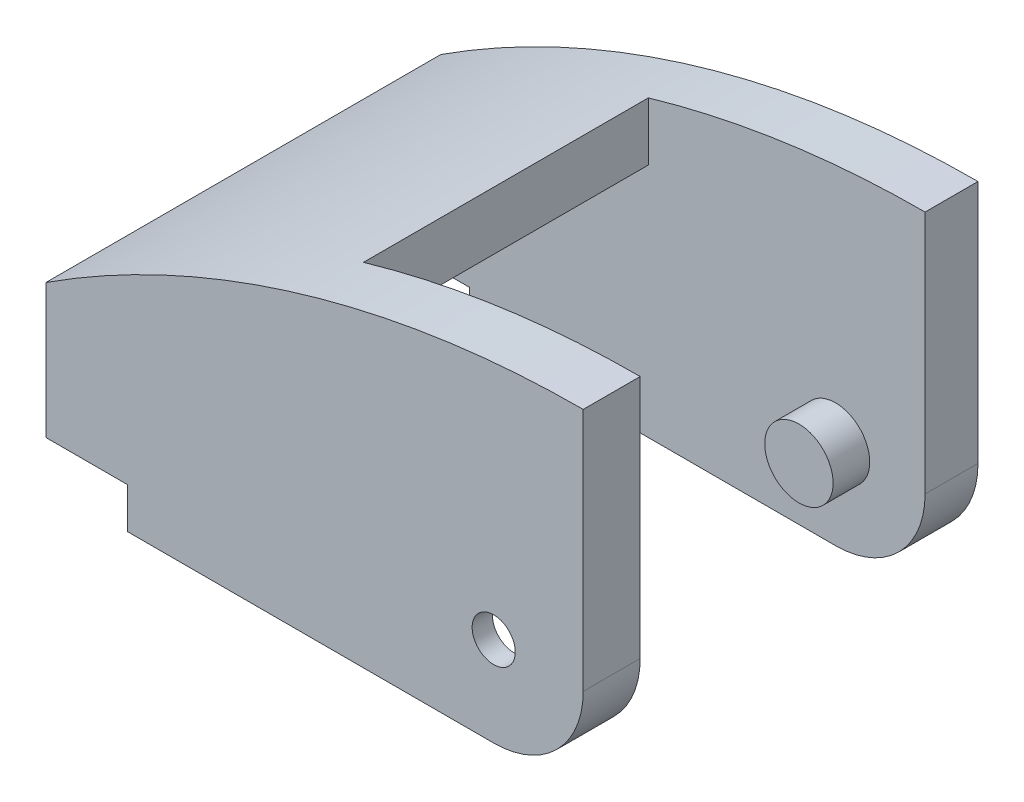
from build123d import *
from build123d.topology import SkipClean

# Parameters (mm, degrees)
SKETCH1_R              = 9.5
BOSS_EXTRUDE1_DEPTH    = 48
CUT_EXTRUDE1_DEPTH     = 62.48170459575759
BOSS_EXTRUDE2_START    = -2.5
SKETCH3_R              = 9.5
SKETCH3_R_2            = 2.4
BOSS_EXTRUDE2_DEPTH    = 2.5
SKETCH4_R              = 9.5
SKETCH4_R_2            = 4.2
BOSS_EXTRUDE3_DEPTH    = 7
SKETCH5_R              = 4.2
BOSS_EXTRUDE4_DEPTH    = 11
BOSS_EXTRUDE5_DEPTH    = 48
CUT_EXTRUDE2_START     = -48
CUT_EXTRUDE2_OUTLINE_R = 2.65
CUT_EXTRUDE2_DEPTH     = 48
CUT_EXTRUDE3_START     = -4.5
SKETCH8_R              = 9.5
CUT_EXTRUDE3_DEPTH     = 4.5
SKETCH9_R              = 6.067807638148196
CUT_EXTRUDE4_DEPTH     = 4.5
SKETCH10_R             = 9.5
BOSS_EXTRUDE6_DEPTH    = 4.5
SKETCH11_R             = 4.2
BOSS_EXTRUDE7_DEPTH    = 3.5
SKETCH12_R             = 2.4
BOSS_EXTRUDE8_DEPTH    = 2.5
CUT_EXTRUDE5_DEPTH     = 14.500000000000005
SKETCH15_R             = 3.436413098279149
BOSS_EXTRUDE9_DEPTH    = 10
BOSS_EXTRUDE10_DEPTH   = 0.5
SKETCH18_R             = 4.2
CUT_EXTRUDE8_DEPTH     = 0.5
CUT_EXTRUDE9_DEPTH     = 69.52919086053767
BOSS_EXTRUDE11_DEPTH   = 6.9999999999999964
CUT_EXTRUDE10_DEPTH    = 99.24586505293748
BOSS_EXTRUDE12_DEPTH   = 41.5
SKETCH25_R             = 4.2
CUT_EXTRUDE11_DEPTH    = 0.5
CUT_EXTRUDE12_DEPTH    = 99.24586505293753
CUT_EXTRUDE13_DEPTH    = 80.2290981899959


# Read off the part's stored shape, not the designer's step: Cut-Extrude2
with BuildPart() as part:
    # Sketch1 → Boss-Extrude1 (new body)
    with BuildSketch(Plane.XY):
        with BuildLine():
            Line((-12, 0), (-12, 30))
            Line((-12, 30), (12, 30))
            Line((12, 30), (12, 0))
            ThreePointArc((12, 0), (-2.2e-15, -12), (-12, 0))
        make_face()
        Circle(SKETCH1_R, mode=Mode.SUBTRACT)
    extrude(amount=-BOSS_EXTRUDE1_DEPTH)

    # Sketch2 → Cut-Extrude1 (cut, through all)
    with BuildSketch(Plane.ZY.offset(12)):
        Polygon((-6.999999999999999, -12), (-41, -12.000000000000004), (-41, 18), (-7.000000000000001, 18.000000000000004), align=None)
    extrude(amount=-CUT_EXTRUDE1_DEPTH, mode=Mode.SUBTRACT)

    # Sketch3 → Boss-Extrude2 (add)
    with BuildSketch(Plane(origin=(0, 0, -48), x_dir=(-1, 0, 0), z_dir=(0, 0, -1)).offset(BOSS_EXTRUDE2_START)):
        Circle(SKETCH3_R)
        Circle(SKETCH3_R_2, mode=Mode.SUBTRACT)
    extrude(amount=BOSS_EXTRUDE2_DEPTH)

    # Sketch4 → Boss-Extrude3 (add)
    with BuildSketch(Plane.XY):
        with Locations(Location((0, 0, 0), (0, 0, 180))):
            Circle(SKETCH4_R)
        Circle(SKETCH4_R_2, mode=Mode.SUBTRACT)
    extrude(amount=-BOSS_EXTRUDE3_DEPTH)

    # Sketch5 → Boss-Extrude4 (add)
    with BuildSketch(Plane.XY):
        Circle(SKETCH5_R)
    extrude(amount=-BOSS_EXTRUDE4_DEPTH)

    # Sketch6 → Boss-Extrude5 (add)
    with BuildSketch(Plane(origin=(0, 0, -48), x_dir=(-1, 0, 0), z_dir=(0, 0, -1))):
        Polygon((12, 30), (12, 18), (17.999999999999925, 18), (38.00000000000001, 18), (38.00000000000001, 30), align=None)
    extrude(amount=-BOSS_EXTRUDE5_DEPTH)

    # Cut-Extrude2 outline → Cut-Extrude2 (cut)
    with BuildSketch(Plane.XY.offset(CUT_EXTRUDE2_START)):
        Circle(CUT_EXTRUDE2_OUTLINE_R)
    extrude(amount=CUT_EXTRUDE2_DEPTH, mode=Mode.SUBTRACT)

    # Sketch8 → Cut-Extrude3 (cut)
    with BuildSketch(Plane(origin=(0, -4e-16, -7), x_dir=(-1, 0, 0), z_dir=(0, -6e-17, -1)).offset(CUT_EXTRUDE3_START)):
        Circle(SKETCH8_R)
    extrude(amount=CUT_EXTRUDE3_DEPTH, mode=Mode.SUBTRACT)


with BuildPart() as cut_extrude3_piece_1:
    # of the separate pieces the step leaves, piece 1, a body of its own (cut_extrude3_pieces)
    add(part.part.solids().sort_by_distance((-12, 0, 0))[0])

    # Sketch10 → Boss-Extrude6 (add)
    with BuildSketch(Plane.XY.offset(-45.5)):
        with Locations(Location((0, 0, 0), (0, 0, 90))):
            Circle(SKETCH10_R)
    extrude(amount=BOSS_EXTRUDE6_DEPTH)

    # Sketch11 → Boss-Extrude7 (add)
    with BuildSketch(Plane.XY.offset(-41)):
        with Locations(Location((0, 0, 0), (0, 0, 180))):
            Circle(SKETCH11_R)
    extrude(amount=BOSS_EXTRUDE7_DEPTH)

    # Sketch12 → Boss-Extrude8 (add)
    with BuildSketch(Plane(origin=(0, 0, -48), x_dir=(-1, 0, 0), z_dir=(0, 0, -1))):
        Circle(SKETCH12_R)
    extrude(amount=-BOSS_EXTRUDE8_DEPTH)

    # Sketch13 → Cut-Extrude5 (cut)
    with BuildSketch(Plane(origin=(0, 30, 0), x_dir=(1, 0, 0), z_dir=(0, 1, 0))):
        Polygon((12, 41), (-23.000000000000004, 41), (-22.999999999999996, 6.999999999999988), (12, 7.000000000000001), align=None)
    extrude(amount=-CUT_EXTRUDE5_DEPTH, mode=Mode.SUBTRACT)

    # Sketch15 → Boss-Extrude9 (add)
    with BuildSketch(Plane(origin=(0, 0, -48), x_dir=(-1, 0, 0), z_dir=(0, 0, -1))):
        Circle(SKETCH15_R)
    extrude(amount=-BOSS_EXTRUDE9_DEPTH)

    # Sketch16 → Boss-Extrude10 (add)
    with BuildSketch(Plane(origin=(0, 0, -48), x_dir=(-1, 0, 0), z_dir=(0, 0, -1))):
        Polygon((38.00000000000001, 30), (-12, 30), (-12, 18), (12, 18), (38.00000000000001, 18), align=None)
        with BuildLine():
            Line((-12, 0), (11.999999999999998, 0))
            ThreePointArc((11.999999999999998, 0), (-2.2e-15, -12), (-12, 0))
        make_face()
        with BuildLine():
            ThreePointArc((11.999999999999998, 0), (7.3e-16, 11.999999999999998), (-11.999999999999998, 1.47e-15))
            Line((-12, 0), (12, 0))
        make_face()
        with BuildLine():
            Line((12, 0), (-12, 0))
            ThreePointArc((-11.999999999999998, 1.47e-15), (-2.2e-15, -11.999999999999998), (11.999999999999998, -2.94e-15))
        make_face()
        with BuildLine():
            Line((12, 18), (-12, 18))
            Line((-12, 18), (-12, 0))
            ThreePointArc((-11.999999999999998, 1.47e-15), (7.3e-16, 11.999999999999998), (11.999999999999998, 0))
            Line((11.999999999999998, 0), (11.999999999999998, 18))
        make_face()
    extrude(amount=BOSS_EXTRUDE10_DEPTH)

    # Sketch18 → Cut-Extrude8 (cut)
    with SkipClean():  # the faces are left unmerged after this step: merging them gives an invalid solid
        with BuildSketch(Plane.XY.offset(-41)):
            with BuildLine():
                Line((12.000000000000004, 30), (-22.999999999999996, 30))
                Line((-22.999999999999996, 30), (-22.999999999999996, 18))
                Line((-22.999999999999996, 18), (-12.000000000000002, 18))
                Line((-12.000000000000002, 18), (-12.000000000000002, 0))
                ThreePointArc((-12, 1.47e-15), (-2.2e-15, -12), (12, -2.94e-15))
                Line((12, 0), (12, 30))
            make_face()
            Circle(SKETCH18_R, mode=Mode.SUBTRACT)
        extrude(amount=-CUT_EXTRUDE8_DEPTH, mode=Mode.SUBTRACT)

    # Sketch19 → Cut-Extrude9 (cut, through all)
    with SkipClean():  # the faces are left unmerged after this step: merging them gives an invalid solid
        with BuildSketch(Plane.XY):
            with BuildLine():
                ThreePointArc((11, -2.69e-15), (-2.02e-15, -11), (-11, 1.35e-15))
                Line((-11, 0), (-12.000000000000002, 0))
                ThreePointArc((-12.000000000000002, 0), (-7.3e-16, -12.000000000000002), (12.000000000000002, -1.47e-15))
                Line((12, 0), (12, 30))
                Line((12, 30), (11, 30))
                Line((11, 30), (11, 0))
            make_face()
        extrude(amount=-CUT_EXTRUDE9_DEPTH, mode=Mode.SUBTRACT)

    # Sketch21 → Boss-Extrude11 (add)
    with SkipClean():  # the faces are left unmerged after this step: merging them gives an invalid solid
        with BuildSketch(Plane.XY):
            with BuildLine():
                Line((-80, -11.000000000000007), (-2.02e-15, -11))
                ThreePointArc((-2.02e-15, -11), (-11, 7.951e-14), (1.5455e-13, 11))
                Line((-9.4e-16, 11), (-2e-17, 29.50098275984317))
                ThreePointArc((1.58451e-12, 29.500982759843026), (-43.87333050880174, 16.901328954446853), (-79.99999999999999, -11.000000000000014))
            make_face()
        boss_extrude11 = extrude(amount=-BOSS_EXTRUDE11_DEPTH)

    # Mirror2: Boss-Extrude11 across plane
    with SkipClean():  # the faces are left unmerged after this step: merging them gives an invalid solid
        add(boss_extrude11.mirror(Plane.XY.offset(-24.25)))

    # Sketch23 → Cut-Extrude10 (cut, through all)
    with SkipClean():  # the faces are left unmerged after this step: merging them gives an invalid solid
        with BuildSketch(Plane.XY):
            with BuildLine():
                Line((11, 30), (-38.00000000000001, 30))
                Line((-38.00000000000001, 30), (-38.00000000000001, 19.680026503546667))
                ThreePointArc((-38.000000000000014, 19.680026503546685), (-14.03748116807828, 27.39201372395351), (10.999999999999979, 30.00000000000003))
            make_face()
        extrude(amount=-CUT_EXTRUDE10_DEPTH, mode=Mode.SUBTRACT)

    # Sketch24 → Boss-Extrude12 (add)
    with BuildSketch(Plane.XY):
        with BuildLine():
            ThreePointArc((-23.00000000000003, 25.145323923706542), (-54.060518829682096, 11.110516861146493), (-80, -11))
            Line((-80, -11.000000000000007), (-75.95443157615205, -11.000000000000004))
            ThreePointArc((-75.95443157615205, -11.000000000000028), (-51.689916223605806, 9.057380529785846), (-22.999999999999986, 22.017084465179764))
            Line((-22.999999999999996, 22.017084465179774), (-23, 25.1453239237065))
        make_face()
    extrude(amount=-BOSS_EXTRUDE12_DEPTH)

    # Sketch25 → Cut-Extrude11 (cut)
    # profile 1 of 4: a face of its own
    with BuildSketch(Plane.XY.offset(-41.5)):
        with BuildLine():
            ThreePointArc((-34.29658362177963, 17.999999999999986), (-56.6966229233105, 5.756871837942555), (-75.95443157615205, -11.000000000000028))
            Line((-75.95443157615205, -11.000000000000007), (0, -11.000000000000007))
            ThreePointArc((-2.02e-15, -11), (-7.778174593052022, 7.778174593052023), (11, 0))
            Line((10.999999999999988, 0), (10.999999999999988, 26.999999999999993))
            ThreePointArc((10.999999999999988, 26.999999999999986), (-6.181599512464837, 25.74765282571859), (-22.999999999996817, 22.017084465180716))
            Line((-23, 22.01708446518151), (-23.000000000000004, 18))
            Line((-23.000000000000004, 18), (-34.29658362177963, 18.000000000000004))
        make_face()
    # profile 2 of 4: a face of its own
    with BuildSketch(Plane.XY.offset(-41.5)):
        with BuildLine():
            ThreePointArc((11, 0), (-7.778174593052022, 7.778174593052023), (-2.02e-15, -11))
            ThreePointArc((-2.02e-15, -11), (7.778174593052021, -7.778174593052024), (11, -2.69e-15))
        make_face()
        Circle(SKETCH25_R, mode=Mode.SUBTRACT)
    # profile 3 of 4: a face of its own
    with BuildSketch(Plane.XY.offset(-41.5)):
        with BuildLine():
            Line((-15.831452239273311, 26.999999999999996), (10.999999999999986, 26.999999999999996))
            Line((11, 26.999999999999996), (11, 30))
            ThreePointArc((10.999999999999591, 30), (-2.49932247622473, 29.24767054972125), (-15.83145223927318, 26.99999999999892))
        make_face()
    # profile 4 of 4: a face of its own
    with BuildSketch(Plane.XY.offset(-41.5)):
        with BuildLine():
            ThreePointArc((-15.83145223927318, 26.99999999999892), (-19.4298595333881, 26.127289318508147), (-22.99999999999981, 25.145323923705888))
            Line((-23, 25.14532392370651), (-23, 22.01708446518151))
            ThreePointArc((-22.999999999996817, 22.017084465180716), (-6.181599512464837, 25.74765282571859), (10.999999999999988, 26.999999999999986))
            Line((10.999999999999986, 26.999999999999996), (-15.831452239273311, 26.999999999999996))
        make_face()
    extrude(amount=-CUT_EXTRUDE11_DEPTH, mode=Mode.SUBTRACT)

    # Sketch26 → Cut-Extrude12 (cut, through all)
    with BuildSketch(Plane(origin=(0, 0, -48.5), x_dir=(-1, 0, 0), z_dir=(0, 0, -1))):
        with BuildLine():
            Line((54.999999999999986, 4.498697742403834), (54.99999999999999, -11))
            Line((55, -11), (70, -11))
            Line((70, -11), (73.20879972555869, -11.000000000000004))
            ThreePointArc((73.2087997255591, -10.99999999999882), (64.50313428378952, -2.7821940147532445), (55.00000000000103, 4.498697742404204))
        make_face()
        with BuildLine():
            Line((54.99999999999998, 10.508698660488534), (54.999999999999986, 4.498697742403834))
            ThreePointArc((55.00000000000103, 4.498697742404204), (64.50313428378952, -2.7821940147532445), (73.2087997255591, -10.99999999999882))
            Line((73.20879972555869, -11.000000000000004), (80, -11.00000000000001))
            ThreePointArc((80, -11), (68.23323816124723, 0.6066070293515935), (54.999999999999986, 10.508698660488534))
        make_face()
    extrude(amount=-CUT_EXTRUDE12_DEPTH, mode=Mode.SUBTRACT)

    # Sketch27 → Cut-Extrude13 (cut, through all)
    with BuildSketch(Plane(origin=(0, 0, -48.5), x_dir=(-1, 0, 0), z_dir=(0, 0, -1))):
        Polygon((54.999999999999986, -11.000000000000005), (44.999999999999986, -11.000000000000007), (44.999999999999986, -6.000000000000005), (54.999999999999986, -6.000000000000004), align=None)
    extrude(amount=-CUT_EXTRUDE13_DEPTH, mode=Mode.SUBTRACT)


with BuildPart() as cut_extrude3_piece_2:
    # of the separate pieces the step leaves, piece 2, a body of its own (cut_extrude3_pieces)
    add(part.part.solids().sort_by_distance((4.2, 0, -7))[0])

    # Sketch9 → Cut-Extrude4 (cut)
    with BuildSketch(Plane(origin=(0, 0, -11), x_dir=(-1, 0, 0), z_dir=(0, 0, -1))):
        Circle(SKETCH9_R)
    extrude(amount=-CUT_EXTRUDE4_DEPTH, mode=Mode.SUBTRACT)


solid = cut_extrude3_piece_1.part
